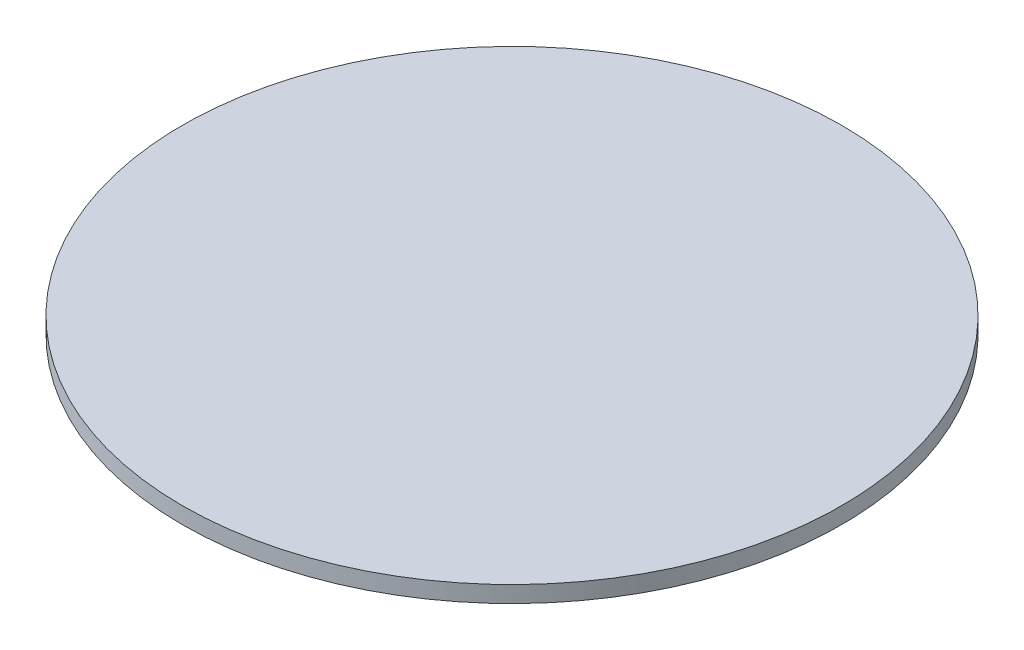
from build123d import *

# Parameters (mm, degrees)
SKETCH2_R           = 4
BOSS_EXTRUDE1_DEPTH = 0.2


with BuildPart() as part:
    # Sketch2 → Boss-Extrude1 (new body)
    with BuildSketch(Plane.XZ.offset(2.284366974)):
        Circle(SKETCH2_R)
    extrude(amount=-BOSS_EXTRUDE1_DEPTH)


solid = part.part
